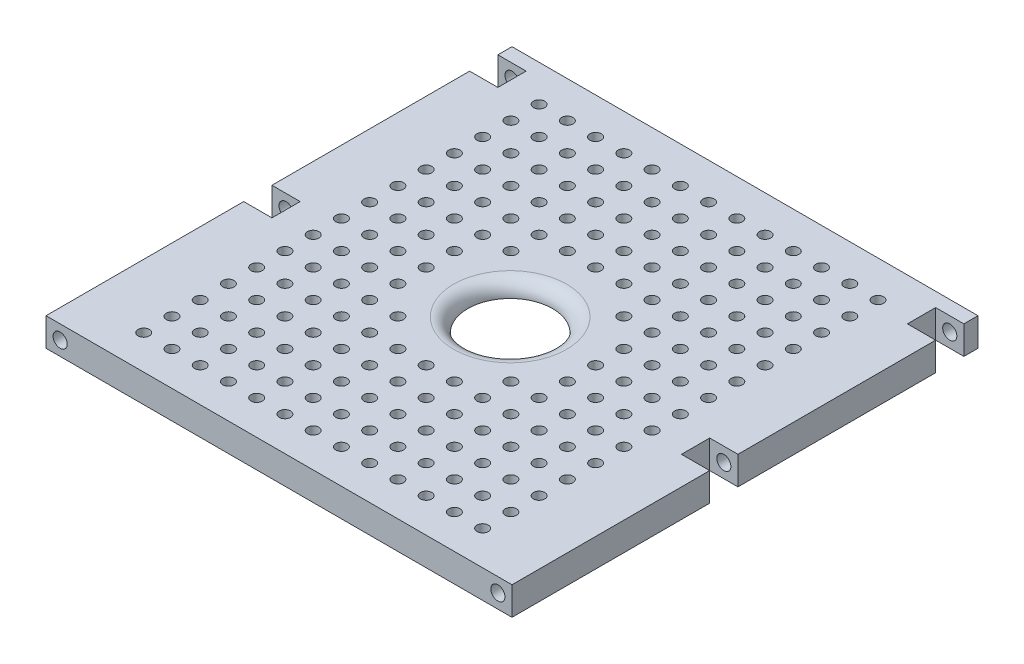
from build123d import *

# Parameters (mm, degrees)
ESQUISSE1_R     = 15
BASE_DEPTH      = 10
ESQUISSE2_R     = 2.5
VIDE_VIS_DEPTH  = 185.746447868
CONGE_CABLE_R   = 5
ESQUISSE3_R     = 2
VIDE_TROU_DEPTH = 118.100384286
ESQUISSE4_W     = 129
ESQUISSE4_H     = 147.70378555
VIDE_1_2_DEPTH  = 5


with BuildPart() as part:
    # Esquisse1 → BASE (new body)
    with BuildSketch(Plane(origin=(0, 0, 0), x_dir=(1, 0, 0), z_dir=(0, 1, 0))):
        Polygon((-82.5, 77.5), (-72.5, 77.5), (-72.5, 67.5), (-82.5, 67.5), (-82.5, -2.5), (-72.5, -2.5), (-72.5, -12.5), (-82.5, -12.5), (-82.5, -82.5), (82.5, -82.5), (82.5, -12.5), (72.5, -12.5), (72.5, -2.5), (82.5, -2.5), (82.5, 67.5), (72.5, 67.5), (72.5, 77.5), (82.5, 77.5), (82.5, 82.5), (-82.5, 82.5), align=None)
        with Locations(Location((0, -0.648107225, 0), (0, 0, 270))):
            Circle(ESQUISSE1_R, mode=Mode.SUBTRACT)
    extrude(amount=BASE_DEPTH)

    # Esquisse2 → VIDE VIS (cut, through all)
    with BuildSketch(Plane(origin=(0, 0, -82.5), x_dir=(-1, 0, 0), z_dir=(0, 0, -1))):
        with Locations((-77.5, 5)):
            Circle(ESQUISSE2_R)
        with Locations(Location((77.5, 5, 0), (0, 0, 180))):
            Circle(ESQUISSE2_R)
    extrude(amount=-VIDE_VIS_DEPTH, mode=Mode.SUBTRACT)

    # CONGE CABLE
    conge_cable_edges = [part.edges().sort_by_distance(p)[0] for p in [
        (0, 0, -14.351892775),
        (0, 10, -14.351892775),
    ]]
    fillet(conge_cable_edges, radius=CONGE_CABLE_R - 0.0001)  # a hair under: the kernel refuses the full size

    # Esquisse3 → VIDE TROU (cut, through all)
    with BuildSketch(Plane(origin=(0, 10, 0), x_dir=(1, 0, 0), z_dir=(0, 1, 0))):
        with Locations(Location((-60, 69.6, 0), (0, 0, 270))):
            Circle(ESQUISSE3_R)
        with Locations(Location((-50, 69.6, 0), (0, 0, 270))):
            Circle(ESQUISSE3_R)
        with Locations(Location((-40, 69.6, 0), (0, 0, 270))):
            Circle(ESQUISSE3_R)
        with Locations(Location((-30, 69.6, 0), (0, 0, 270))):
            Circle(ESQUISSE3_R)
        with Locations(Location((-20, 69.6, 0), (0, 0, 270))):
            Circle(ESQUISSE3_R)
        with Locations(Location((-10, 69.6, 0), (0, 0, 270))):
            Circle(ESQUISSE3_R)
        with Locations(Location((0, 69.6, 0), (0, 0, 270))):
            Circle(ESQUISSE3_R)
        with Locations(Location((10, 69.6, 0), (0, 0, 270))):
            Circle(ESQUISSE3_R)
        with Locations(Location((20, 69.6, 0), (0, 0, 270))):
            Circle(ESQUISSE3_R)
        with Locations(Location((30, 69.6, 0), (0, 0, 270))):
            Circle(ESQUISSE3_R)
        with Locations(Location((40, 69.6, 0), (0, 0, 270))):
            Circle(ESQUISSE3_R)
        with Locations(Location((50, 69.6, 0), (0, 0, 270))):
            Circle(ESQUISSE3_R)
        with Locations(Location((60, 69.6, 0), (0, 0, 270))):
            Circle(ESQUISSE3_R)
        with Locations(Location((-50, 59.6, 0), (0, 0, 270))):
            Circle(ESQUISSE3_R)
        with Locations(Location((-40, 59.6, 0), (0, 0, 270))):
            Circle(ESQUISSE3_R)
        with Locations(Location((-30, 59.6, 0), (0, 0, 270))):
            Circle(ESQUISSE3_R)
        with Locations(Location((-20, 59.6, 0), (0, 0, 270))):
            Circle(ESQUISSE3_R)
        with Locations(Location((-10, 59.6, 0), (0, 0, 270))):
            Circle(ESQUISSE3_R)
        with Locations(Location((0, 59.6, 0), (0, 0, 270))):
            Circle(ESQUISSE3_R)
        with Locations(Location((10, 59.6, 0), (0, 0, 270))):
            Circle(ESQUISSE3_R)
        with Locations(Location((20, 59.6, 0), (0, 0, 270))):
            Circle(ESQUISSE3_R)
        with Locations(Location((30, 59.6, 0), (0, 0, 270))):
            Circle(ESQUISSE3_R)
        with Locations(Location((40, 59.6, 0), (0, 0, 270))):
            Circle(ESQUISSE3_R)
        with Locations(Location((50, 59.6, 0), (0, 0, 270))):
            Circle(ESQUISSE3_R)
        with Locations(Location((60, 59.6, 0), (0, 0, 270))):
            Circle(ESQUISSE3_R)
        with Locations(Location((-50, 49.6, 0), (0, 0, 270))):
            Circle(ESQUISSE3_R)
        with Locations(Location((-40, 49.6, 0), (0, 0, 270))):
            Circle(ESQUISSE3_R)
        with Locations(Location((-30, 49.6, 0), (0, 0, 270))):
            Circle(ESQUISSE3_R)
        with Locations(Location((-20, 49.6, 0), (0, 0, 270))):
            Circle(ESQUISSE3_R)
        with Locations(Location((-10, 49.6, 0), (0, 0, 270))):
            Circle(ESQUISSE3_R)
        with Locations(Location((0, 49.6, 0), (0, 0, 270))):
            Circle(ESQUISSE3_R)
        with Locations(Location((10, 49.6, 0), (0, 0, 270))):
            Circle(ESQUISSE3_R)
        with Locations(Location((20, 49.6, 0), (0, 0, 270))):
            Circle(ESQUISSE3_R)
        with Locations(Location((30, 49.6, 0), (0, 0, 270))):
            Circle(ESQUISSE3_R)
        with Locations(Location((40, 49.6, 0), (0, 0, 270))):
            Circle(ESQUISSE3_R)
        with Locations(Location((50, 49.6, 0), (0, 0, 270))):
            Circle(ESQUISSE3_R)
        with Locations(Location((60, 49.6, 0), (0, 0, 270))):
            Circle(ESQUISSE3_R)
        with Locations(Location((-50, 39.6, 0), (0, 0, 270))):
            Circle(ESQUISSE3_R)
        with Locations(Location((-40, 39.6, 0), (0, 0, 270))):
            Circle(ESQUISSE3_R)
        with Locations(Location((-30, 39.6, 0), (0, 0, 270))):
            Circle(ESQUISSE3_R)
        with Locations(Location((-20, 39.6, 0), (0, 0, 270))):
            Circle(ESQUISSE3_R)
        with Locations(Location((-10, 39.6, 0), (0, 0, 270))):
            Circle(ESQUISSE3_R)
        with Locations(Location((0, 39.6, 0), (0, 0, 270))):
            Circle(ESQUISSE3_R)
        with Locations(Location((10, 39.6, 0), (0, 0, 270))):
            Circle(ESQUISSE3_R)
        with Locations(Location((20, 39.6, 0), (0, 0, 270))):
            Circle(ESQUISSE3_R)
        with Locations(Location((30, 39.6, 0), (0, 0, 270))):
            Circle(ESQUISSE3_R)
        with Locations(Location((40, 39.6, 0), (0, 0, 270))):
            Circle(ESQUISSE3_R)
        with Locations(Location((50, 39.6, 0), (0, 0, 270))):
            Circle(ESQUISSE3_R)
        with Locations(Location((60, 39.6, 0), (0, 0, 270))):
            Circle(ESQUISSE3_R)
        with Locations(Location((-50, 29.6, 0), (0, 0, 270))):
            Circle(ESQUISSE3_R)
        with Locations(Location((-40, 29.6, 0), (0, 0, 270))):
            Circle(ESQUISSE3_R)
        with Locations(Location((-30, 29.6, 0), (0, 0, 270))):
            Circle(ESQUISSE3_R)
        with Locations(Location((-20, 29.6, 0), (0, 0, 270))):
            Circle(ESQUISSE3_R)
        with Locations(Location((-10, 29.6, 0), (0, 0, 270))):
            Circle(ESQUISSE3_R)
        with Locations(Location((0, 29.6, 0), (0, 0, 270))):
            Circle(ESQUISSE3_R)
        with Locations(Location((10, 29.6, 0), (0, 0, 270))):
            Circle(ESQUISSE3_R)
        with Locations(Location((20, 29.6, 0), (0, 0, 270))):
            Circle(ESQUISSE3_R)
        with Locations(Location((30, 29.6, 0), (0, 0, 270))):
            Circle(ESQUISSE3_R)
        with Locations(Location((40, 29.6, 0), (0, 0, 270))):
            Circle(ESQUISSE3_R)
        with Locations(Location((50, 29.6, 0), (0, 0, 270))):
            Circle(ESQUISSE3_R)
        with Locations(Location((60, 29.6, 0), (0, 0, 270))):
            Circle(ESQUISSE3_R)
        with Locations(Location((-50, 19.6, 0), (0, 0, 270))):
            Circle(ESQUISSE3_R)
        with Locations(Location((-40, 19.6, 0), (0, 0, 270))):
            Circle(ESQUISSE3_R)
        with Locations(Location((-30, 19.6, 0), (0, 0, 270))):
            Circle(ESQUISSE3_R)
        with Locations(Location((-20, 19.6, 0), (0, 0, 270))):
            Circle(ESQUISSE3_R)
        with Locations(Location((20, 19.6, 0), (0, 0, 270))):
            Circle(ESQUISSE3_R)
        with Locations(Location((30, 19.6, 0), (0, 0, 270))):
            Circle(ESQUISSE3_R)
        with Locations(Location((40, 19.6, 0), (0, 0, 270))):
            Circle(ESQUISSE3_R)
        with Locations(Location((50, 19.6, 0), (0, 0, 270))):
            Circle(ESQUISSE3_R)
        with Locations(Location((60, 19.6, 0), (0, 0, 270))):
            Circle(ESQUISSE3_R)
        with Locations(Location((-50, 9.6, 0), (0, 0, 270))):
            Circle(ESQUISSE3_R)
        with Locations(Location((-40, 9.6, 0), (0, 0, 270))):
            Circle(ESQUISSE3_R)
        with Locations(Location((-30, 9.6, 0), (0, 0, 270))):
            Circle(ESQUISSE3_R)
        with Locations(Location((30, 9.6, 0), (0, 0, 270))):
            Circle(ESQUISSE3_R)
        with Locations(Location((40, 9.6, 0), (0, 0, 270))):
            Circle(ESQUISSE3_R)
        with Locations(Location((50, 9.6, 0), (0, 0, 270))):
            Circle(ESQUISSE3_R)
        with Locations(Location((60, 9.6, 0), (0, 0, 270))):
            Circle(ESQUISSE3_R)
        with Locations(Location((-50, -0.4, 0), (0, 0, 270))):
            Circle(ESQUISSE3_R)
        with Locations(Location((-40, -0.4, 0), (0, 0, 270))):
            Circle(ESQUISSE3_R)
        with Locations(Location((-30, -0.4, 0), (0, 0, 270))):
            Circle(ESQUISSE3_R)
        with Locations(Location((30, -0.4, 0), (0, 0, 270))):
            Circle(ESQUISSE3_R)
        with Locations(Location((40, -0.4, 0), (0, 0, 270))):
            Circle(ESQUISSE3_R)
        with Locations(Location((50, -0.4, 0), (0, 0, 270))):
            Circle(ESQUISSE3_R)
        with Locations(Location((60, -0.4, 0), (0, 0, 270))):
            Circle(ESQUISSE3_R)
        with Locations(Location((-50, -10.4, 0), (0, 0, 270))):
            Circle(ESQUISSE3_R)
        with Locations(Location((-40, -10.4, 0), (0, 0, 270))):
            Circle(ESQUISSE3_R)
        with Locations(Location((-30, -10.4, 0), (0, 0, 270))):
            Circle(ESQUISSE3_R)
        with Locations(Location((30, -10.4, 0), (0, 0, 270))):
            Circle(ESQUISSE3_R)
        with Locations(Location((40, -10.4, 0), (0, 0, 270))):
            Circle(ESQUISSE3_R)
        with Locations(Location((50, -10.4, 0), (0, 0, 270))):
            Circle(ESQUISSE3_R)
        with Locations(Location((60, -10.4, 0), (0, 0, 270))):
            Circle(ESQUISSE3_R)
        with Locations(Location((-50, -20.4, 0), (0, 0, 270))):
            Circle(ESQUISSE3_R)
        with Locations(Location((-40, -20.4, 0), (0, 0, 270))):
            Circle(ESQUISSE3_R)
        with Locations(Location((-30, -20.4, 0), (0, 0, 270))):
            Circle(ESQUISSE3_R)
        with Locations(Location((-20, -20.4, 0), (0, 0, 270))):
            Circle(ESQUISSE3_R)
        with Locations(Location((20, -20.4, 0), (0, 0, 270))):
            Circle(ESQUISSE3_R)
        with Locations(Location((30, -20.4, 0), (0, 0, 270))):
            Circle(ESQUISSE3_R)
        with Locations(Location((40, -20.4, 0), (0, 0, 270))):
            Circle(ESQUISSE3_R)
        with Locations(Location((50, -20.4, 0), (0, 0, 270))):
            Circle(ESQUISSE3_R)
        with Locations(Location((60, -20.4, 0), (0, 0, 270))):
            Circle(ESQUISSE3_R)
        with Locations(Location((-50, -30.4, 0), (0, 0, 270))):
            Circle(ESQUISSE3_R)
        with Locations(Location((-40, -30.4, 0), (0, 0, 270))):
            Circle(ESQUISSE3_R)
        with Locations(Location((-30, -30.4, 0), (0, 0, 270))):
            Circle(ESQUISSE3_R)
        with Locations(Location((-20, -30.4, 0), (0, 0, 270))):
            Circle(ESQUISSE3_R)
        with Locations(Location((-10, -30.4, 0), (0, 0, 270))):
            Circle(ESQUISSE3_R)
        with Locations(Location((0, -30.4, 0), (0, 0, 270))):
            Circle(ESQUISSE3_R)
        with Locations(Location((10, -30.4, 0), (0, 0, 270))):
            Circle(ESQUISSE3_R)
        with Locations(Location((20, -30.4, 0), (0, 0, 270))):
            Circle(ESQUISSE3_R)
        with Locations(Location((30, -30.4, 0), (0, 0, 270))):
            Circle(ESQUISSE3_R)
        with Locations(Location((40, -30.4, 0), (0, 0, 270))):
            Circle(ESQUISSE3_R)
        with Locations(Location((50, -30.4, 0), (0, 0, 270))):
            Circle(ESQUISSE3_R)
        with Locations(Location((60, -30.4, 0), (0, 0, 270))):
            Circle(ESQUISSE3_R)
        with Locations(Location((-50, -40.4, 0), (0, 0, 270))):
            Circle(ESQUISSE3_R)
        with Locations(Location((-40, -40.4, 0), (0, 0, 270))):
            Circle(ESQUISSE3_R)
        with Locations(Location((-30, -40.4, 0), (0, 0, 270))):
            Circle(ESQUISSE3_R)
        with Locations(Location((-20, -40.4, 0), (0, 0, 270))):
            Circle(ESQUISSE3_R)
        with Locations(Location((-10, -40.4, 0), (0, 0, 270))):
            Circle(ESQUISSE3_R)
        with Locations(Location((0, -40.4, 0), (0, 0, 270))):
            Circle(ESQUISSE3_R)
        with Locations(Location((10, -40.4, 0), (0, 0, 270))):
            Circle(ESQUISSE3_R)
        with Locations(Location((20, -40.4, 0), (0, 0, 270))):
            Circle(ESQUISSE3_R)
        with Locations(Location((30, -40.4, 0), (0, 0, 270))):
            Circle(ESQUISSE3_R)
        with Locations(Location((40, -40.4, 0), (0, 0, 270))):
            Circle(ESQUISSE3_R)
        with Locations(Location((50, -40.4, 0), (0, 0, 270))):
            Circle(ESQUISSE3_R)
        with Locations(Location((60, -40.4, 0), (0, 0, 270))):
            Circle(ESQUISSE3_R)
        with Locations(Location((-50, -50.4, 0), (0, 0, 270))):
            Circle(ESQUISSE3_R)
        with Locations(Location((-40, -50.4, 0), (0, 0, 270))):
            Circle(ESQUISSE3_R)
        with Locations(Location((-30, -50.4, 0), (0, 0, 270))):
            Circle(ESQUISSE3_R)
        with Locations(Location((-20, -50.4, 0), (0, 0, 270))):
            Circle(ESQUISSE3_R)
        with Locations(Location((-10, -50.4, 0), (0, 0, 270))):
            Circle(ESQUISSE3_R)
        with Locations(Location((0, -50.4, 0), (0, 0, 270))):
            Circle(ESQUISSE3_R)
        with Locations(Location((10, -50.4, 0), (0, 0, 270))):
            Circle(ESQUISSE3_R)
        with Locations(Location((20, -50.4, 0), (0, 0, 270))):
            Circle(ESQUISSE3_R)
        with Locations(Location((30, -50.4, 0), (0, 0, 270))):
            Circle(ESQUISSE3_R)
        with Locations(Location((40, -50.4, 0), (0, 0, 270))):
            Circle(ESQUISSE3_R)
        with Locations(Location((50, -50.4, 0), (0, 0, 270))):
            Circle(ESQUISSE3_R)
        with Locations(Location((60, -50.4, 0), (0, 0, 270))):
            Circle(ESQUISSE3_R)
        with Locations(Location((-50, -60.4, 0), (0, 0, 270))):
            Circle(ESQUISSE3_R)
        with Locations(Location((-40, -60.4, 0), (0, 0, 270))):
            Circle(ESQUISSE3_R)
        with Locations(Location((-30, -60.4, 0), (0, 0, 270))):
            Circle(ESQUISSE3_R)
        with Locations(Location((-20, -60.4, 0), (0, 0, 270))):
            Circle(ESQUISSE3_R)
        with Locations(Location((-10, -60.4, 0), (0, 0, 270))):
            Circle(ESQUISSE3_R)
        with Locations(Location((0, -60.4, 0), (0, 0, 270))):
            Circle(ESQUISSE3_R)
        with Locations(Location((10, -60.4, 0), (0, 0, 270))):
            Circle(ESQUISSE3_R)
        with Locations(Location((20, -60.4, 0), (0, 0, 270))):
            Circle(ESQUISSE3_R)
        with Locations(Location((30, -60.4, 0), (0, 0, 270))):
            Circle(ESQUISSE3_R)
        with Locations(Location((40, -60.4, 0), (0, 0, 270))):
            Circle(ESQUISSE3_R)
        with Locations(Location((50, -60.4, 0), (0, 0, 270))):
            Circle(ESQUISSE3_R)
        with Locations(Location((60, -60.4, 0), (0, 0, 270))):
            Circle(ESQUISSE3_R)
        with Locations(Location((-50, -70.4, 0), (0, 0, 270))):
            Circle(ESQUISSE3_R)
        with Locations(Location((-40, -70.4, 0), (0, 0, 270))):
            Circle(ESQUISSE3_R)
        with Locations(Location((-30, -70.4, 0), (0, 0, 270))):
            Circle(ESQUISSE3_R)
        with Locations(Location((-20, -70.4, 0), (0, 0, 270))):
            Circle(ESQUISSE3_R)
        with Locations(Location((-10, -70.4, 0), (0, 0, 270))):
            Circle(ESQUISSE3_R)
        with Locations(Location((0, -70.4, 0), (0, 0, 270))):
            Circle(ESQUISSE3_R)
        with Locations(Location((10, -70.4, 0), (0, 0, 270))):
            Circle(ESQUISSE3_R)
        with Locations(Location((20, -70.4, 0), (0, 0, 270))):
            Circle(ESQUISSE3_R)
        with Locations(Location((30, -70.4, 0), (0, 0, 270))):
            Circle(ESQUISSE3_R)
        with Locations(Location((40, -70.4, 0), (0, 0, 270))):
            Circle(ESQUISSE3_R)
        with Locations(Location((50, -70.4, 0), (0, 0, 270))):
            Circle(ESQUISSE3_R)
        with Locations(Location((60, -70.4, 0), (0, 0, 270))):
            Circle(ESQUISSE3_R)
        with Locations(Location((-60, 59.6, 0), (0, 0, 270))):
            Circle(ESQUISSE3_R)
        with Locations(Location((-60, 49.6, 0), (0, 0, 270))):
            Circle(ESQUISSE3_R)
        with Locations(Location((-60, 39.6, 0), (0, 0, 270))):
            Circle(ESQUISSE3_R)
        with Locations(Location((-60, 29.6, 0), (0, 0, 270))):
            Circle(ESQUISSE3_R)
        with Locations(Location((-60, 19.6, 0), (0, 0, 270))):
            Circle(ESQUISSE3_R)
        with Locations(Location((-60, 9.6, 0), (0, 0, 270))):
            Circle(ESQUISSE3_R)
        with Locations(Location((-60, -0.4, 0), (0, 0, 270))):
            Circle(ESQUISSE3_R)
        with Locations(Location((-60, -10.4, 0), (0, 0, 270))):
            Circle(ESQUISSE3_R)
        with Locations(Location((-60, -20.4, 0), (0, 0, 270))):
            Circle(ESQUISSE3_R)
        with Locations(Location((-60, -30.4, 0), (0, 0, 270))):
            Circle(ESQUISSE3_R)
        with Locations(Location((-60, -40.4, 0), (0, 0, 270))):
            Circle(ESQUISSE3_R)
        with Locations(Location((-60, -50.4, 0), (0, 0, 270))):
            Circle(ESQUISSE3_R)
        with Locations(Location((-60, -60.4, 0), (0, 0, 270))):
            Circle(ESQUISSE3_R)
        with Locations(Location((-60, -70.4, 0), (0, 0, 270))):
            Circle(ESQUISSE3_R)
    extrude(amount=-VIDE_TROU_DEPTH, mode=Mode.SUBTRACT)

    # Esquisse4 → VIDE 1/2 (cut)
    with BuildSketch(Plane.XZ):
        with Locations((0, 0.648107225)):
            Rectangle(ESQUISSE4_W, ESQUISSE4_H)
    extrude(amount=-VIDE_1_2_DEPTH, mode=Mode.SUBTRACT)


solid = part.part
